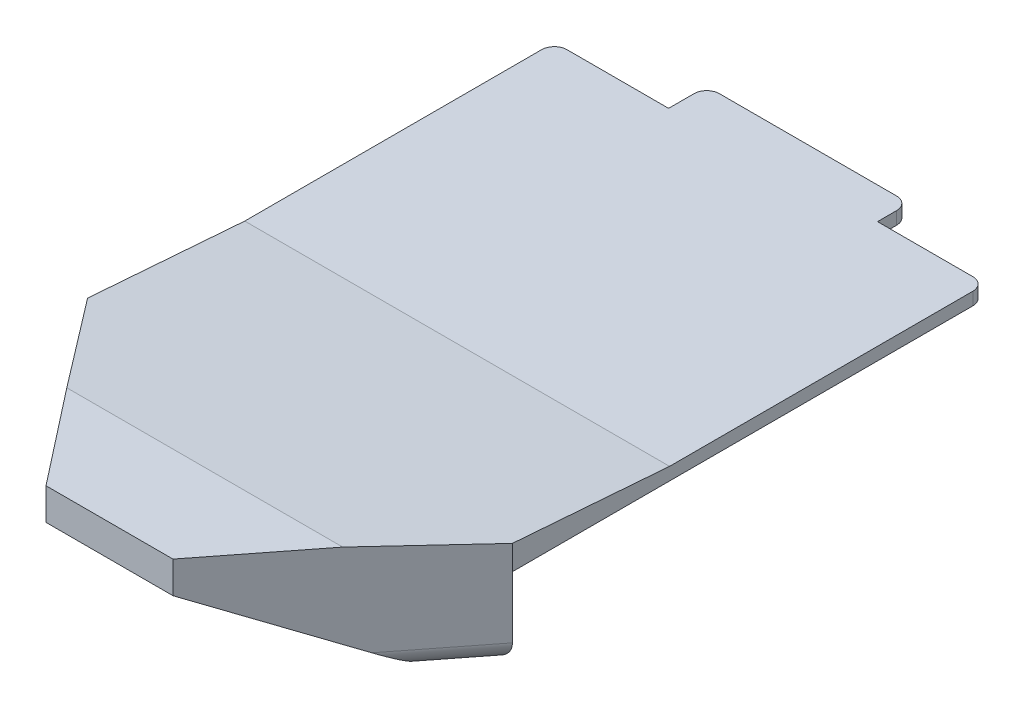
from build123d import *

# Parameters (mm, degrees)
BOSS_EXTRUDE1_DEPTH     = 7.7
SKETCH2_W               = 7
SKETCH2_H               = 3.1
CUT_EXTRUDE1_DEPTH      = 79.027559234
FILLET1_R               = 10
BOSS_EXTRUDE2_DEPTH     = 2
BOSS_EXTRUDE3_DEPTH     = 33.45
BOSS_EXTRUDE4_REACH     = 112.929
CUT_EXTRUDE2_DEPTH      = 111.928772192
CUT_EXTRUDE2_DEPTH_BACK = 111.928772192
CUT_EXTRUDE3_DEPTH      = 10
FILLET3_R               = 1
FILLET5_R               = 3
CUT_EXTRUDE4_REACH      = 113.176
SKETCH8_W               = 17
SKETCH8_H               = 5
SKETCH8_W_2             = 19
SKETCH8_H_2             = 7
FILLET6_R               = 2
FILLET7_R               = 2


with BuildPart() as part:
    # Sketch1 → Boss-Extrude1 (new body)
    with BuildSketch(Plane(origin=(0, 0, 0), x_dir=(1, 0, 0), z_dir=(0, 1, 0))):
        Polygon((0, 0), (-16.35, 0), (-16.35, -9.85), (-2.6, -9.85), (-2.6, -33), (-20.1, -33), (-20.1, -75), (0, -75), align=None)
    extrude(amount=BOSS_EXTRUDE1_DEPTH)

    # Sketch2 → Cut-Extrude1 (cut, through all)
    with BuildSketch(Plane.XY.offset(75)):
        with Locations((-16.6, 3.55)):
            Rectangle(SKETCH2_W, SKETCH2_H)
    extrude(amount=-CUT_EXTRUDE1_DEPTH, mode=Mode.SUBTRACT)

    # Fillet1
    fillet1_edges = [part.edges().sort_by_distance(p)[0] for p in [
        (-2.6, 3.85, 33),
    ]]
    fillet(fillet1_edges, radius=FILLET1_R)

    # Sketch3 → Boss-Extrude2 (add)
    with BuildSketch(Plane(origin=(0, 7.7, 0), x_dir=(1, 0, 0), z_dir=(0, 1, 0))):
        Polygon((0, 4.5), (-33.45, 4.5), (-33.45, -75), (-10, -105), (0, -105), align=None)
    extrude(amount=BOSS_EXTRUDE2_DEPTH)

    # Sketch4 → Boss-Extrude3 (add)
    with BuildSketch(Plane(origin=(0, 0, 0), x_dir=(0, 0, -1), z_dir=(1, 0, 0))):
        Polygon((-105, 9.7), (-105, 12.7), (-90, 12.7), (-50.25, 9.7), align=None)
    extrude(amount=-BOSS_EXTRUDE3_DEPTH)

    # Boss-Extrude4: up to this face of the body (flat: up to its plane)
    boss_extrude4_end = Plane(part.part.faces().sort_by_distance((0, 5.848980441, 46.191947566))[0])
    # Sketch5 → Boss-Extrude4 (add, up to the picked face)
    with BuildSketch(Plane.ZY.offset(33.45), mode=Mode.PRIVATE) as boss_extrude4_sk1:
        Polygon((75, 7.7), (75, -5), (82, -5), (105, 7.7), align=None)
    boss_extrude4_tool1 = split(extrude(boss_extrude4_sk1.sketch, amount=-BOSS_EXTRUDE4_REACH, mode=Mode.PRIVATE), bisect_by=boss_extrude4_end, keep=Keep.BOTH, mode=Mode.PRIVATE)
    add(boss_extrude4_tool1.solids().sort_by(Axis((-33.45, 2.665766, 85.441441), (1, 0, 0)))[0])

    # Sketch6 → Cut-Extrude2 (cut, two sides: drawn at the far end of the back side and taken through both)
    with BuildSketch(Plane(origin=(0, 7.7, 0), x_dir=(1, 0, 0), z_dir=(0, 1, 0)).offset(-CUT_EXTRUDE2_DEPTH_BACK)):
        Polygon((-33.45, -75), (-10, -105), (-33.45, -105), align=None)
    extrude(amount=CUT_EXTRUDE2_DEPTH + CUT_EXTRUDE2_DEPTH_BACK, mode=Mode.SUBTRACT)

    # Sketch7 → Cut-Extrude3 (cut)
    with BuildSketch(Plane(origin=(0, 0, 0), x_dir=(0, 0, -1), z_dir=(1, 0, 0))):
        Polygon((-75, 0), (-85, 0), (-80, -5), (-75, -5), align=None)
    extrude(amount=-CUT_EXTRUDE3_DEPTH, mode=Mode.SUBTRACT)

    # Fillet3
    # the kernel refuses this fillet: 1 mm, written as the material it takes off along each edge
    with BuildSketch(Plane(origin=(5.810983209, -5, 80), x_dir=(0, 0, 1), z_dir=(-1, 0, 0))) as fillet3_piece_1:
        with BuildLine():
            CenterArc((2.350701034, 0.936487472), FILLET3_R, 135, 114.469800521)
            Line((1.643594253, 1.643594253), (1.629452117, 1.657736389))
            Line((1.629452117, 1.657736389), (-0.014142136, 0.014142136))
            Line((-0.014142136, 0.014142136), (0, -0.02))
            ThreePointArc((0, -0.02), (1, -0.02), (1.992985979, -0.018729749))
            Line((1.992985979, -0.018729749), (2, 0))
        make_face()
    extrude(amount=15.810983209, mode=Mode.SUBTRACT)
    with BuildSketch(Plane(origin=(-10, -5, 82.5), x_dir=(-1, 0, 0), z_dir=(0, 0, -1))) as fillet3_piece_2_section:
        with BuildLine():
            CenterArc((FILLET3_R, FILLET3_R), FILLET3_R, 180, 90)
            Line((0, FILLET3_R), (-FILLET3_R * 0.02, FILLET3_R))
            Line((-FILLET3_R * 0.02, FILLET3_R), (-FILLET3_R * 0.02, -FILLET3_R * 0.02))
            Line((-FILLET3_R * 0.02, -FILLET3_R * 0.02), (FILLET3_R, -FILLET3_R * 0.02))
            Line((FILLET3_R, -FILLET3_R * 0.02), (FILLET3_R, 0))
        make_face()
    fillet3_piece_2 = extrude(amount=10, mode=Mode.PRIVATE)
    fillet3_piece_2 = split(fillet3_piece_2, bisect_by=Plane(origin=(-10.222841489, -6.700692184, 78.299307816), z_dir=(0, 0.7071067811865466, -0.7071067811865485)), keep=Keep.TOP, mode=Mode.PRIVATE)
    add(fillet3_piece_2, mode=Mode.SUBTRACT)
    with BuildSketch(Plane(origin=(5.810983209, -5, 80), x_dir=(0, 0, 1), z_dir=(-1, 0, 0))) as fillet3_piece_3a_section:
        with BuildLine():
            CenterArc((2.350701034, 0.936487472), FILLET3_R, 135, 114.469800521)
            Line((1.643594253, 1.643594253), (1.629452117, 1.657736389))
            Line((1.629452117, 1.657736389), (-0.014142136, 0.014142136))
            Line((-0.014142136, 0.014142136), (0, -0.02))
            ThreePointArc((0, -0.02), (1, -0.02), (1.992985979, -0.018729749))
            Line((1.992985979, -0.018729749), (2, 0))
        make_face()
    fillet3_piece_3a = extrude(amount=21.621966417, mode=Mode.PRIVATE)
    fillet3_piece_3a = split(fillet3_piece_3a, bisect_by=Plane(origin=(-10, -4.567151235, 80.996776665), z_dir=(-1, 0, 0)), keep=Keep.TOP, mode=Mode.PRIVATE)
    with BuildSketch(Plane(origin=(-10, -5, 82.5), x_dir=(-1, 0, 0), z_dir=(0, 0, -1))) as fillet3_piece_3b_section:
        with BuildLine():
            CenterArc((FILLET3_R, FILLET3_R), FILLET3_R, 180, 90)
            Line((0, FILLET3_R), (-FILLET3_R * 0.02, FILLET3_R))
            Line((-FILLET3_R * 0.02, FILLET3_R), (-FILLET3_R * 0.02, -FILLET3_R * 0.02))
            Line((-FILLET3_R * 0.02, -FILLET3_R * 0.02), (FILLET3_R, -FILLET3_R * 0.02))
            Line((FILLET3_R, -FILLET3_R * 0.02), (FILLET3_R, 0))
        make_face()
    fillet3_piece_3b = extrude(amount=10, mode=Mode.PRIVATE)
    fillet3_piece_3b = split(fillet3_piece_3b, bisect_by=Plane(origin=(-10.238471404, -4.220535034, 80.779464966), z_dir=(0, -0.7071067811865466, 0.7071067811865485)), keep=Keep.TOP, mode=Mode.PRIVATE)
    fillet3_piece_3 = fillet3_piece_3a & fillet3_piece_3b
    add(fillet3_piece_3, mode=Mode.SUBTRACT)

    # Mirror1: part across plane


with BuildPart() as part_1:
    add(part.part)
    add(part.part.mirror(Plane(origin=(0, 7.7, 75), x_dir=(0, 0, 1), z_dir=(-1, 0, 0))))

    # Fillet5
    # the kernel refuses this fillet: 3 mm, written as the material it takes off along each edge
    with BuildSketch(Plane(origin=(-38.068859068, -5, 69.091011854), x_dir=(0, 1, 0), z_dir=(0.6158478756904763, 0, 0.7878650861711843)), Plane(origin=(38.068859068, -5, 69.091011854), x_dir=(-0.7878650861711843, 0, -0.6158478756904764), z_dir=(-0.6158478756904763, 0, 0.7878650861711843))) as fillet5_piece_1:
        with BuildLine():
            CenterArc((FILLET5_R, -FILLET5_R), FILLET5_R, 90, 90)
            Line((0, -FILLET5_R), (0, 0))
            Line((0, 0), (FILLET5_R, 0))
        make_face()
    extrude(amount=23.884769896, mode=Mode.SUBTRACT)

    # Cut-Extrude4: up to this face of the body (flat: up to its plane)
    cut_extrude4_end = Plane(part_1.part.faces().sort_by_distance((0, 0, 47.459676899))[0])
    # Sketch8 → Cut-Extrude4 (cut, up to the picked face)
    with BuildSketch(Plane(origin=(0, 9.7, 0), x_dir=(1, 0, 0), z_dir=(0, 1, 0)), mode=Mode.PRIVATE) as cut_extrude4_sk1:
        with Locations((24.95, 2)):
            Rectangle(SKETCH8_W, SKETCH8_H)
    cut_extrude4_tool1 = split(extrude(cut_extrude4_sk1.sketch, amount=-CUT_EXTRUDE4_REACH, mode=Mode.PRIVATE), bisect_by=cut_extrude4_end, keep=Keep.BOTH, mode=Mode.PRIVATE)
    # Sketch8 → Cut-Extrude4 (cut, up to the picked face)
    with BuildSketch(Plane(origin=(0, 9.7, 0), x_dir=(1, 0, 0), z_dir=(0, 1, 0)), mode=Mode.PRIVATE) as cut_extrude4_sk2:
        with Locations((-24.95, 2)):
            Rectangle(SKETCH8_W_2, SKETCH8_H_2)
    cut_extrude4_tool2 = split(extrude(cut_extrude4_sk2.sketch, amount=-CUT_EXTRUDE4_REACH, mode=Mode.PRIVATE), bisect_by=cut_extrude4_end, keep=Keep.BOTH, mode=Mode.PRIVATE)
    add(cut_extrude4_tool1.solids().sort_by(Axis((24.95, 9.7, -2), (0, -1, 0)))[0], mode=Mode.SUBTRACT)
    add(cut_extrude4_tool2.solids().sort_by(Axis((-24.95, 9.7, -2), (0, -1, 0)))[0], mode=Mode.SUBTRACT)

    # Fillet6
    fillet6_edges = [part_1.edges().sort_by_distance(p)[0] for p in [
        (-15.45, 8.7, -4.5),
        (-33.45, 8.7, 1.5),
    ]]
    fillet(fillet6_edges, radius=FILLET6_R)

    # Fillet7
    fillet7_edges = [part_1.edges().sort_by_distance(p)[0] for p in [
        (33.45, 8.7, 0.5),
        (16.45, 8.7, -4.5),
    ]]
    fillet(fillet7_edges, radius=FILLET7_R)


solid = part_1.part
